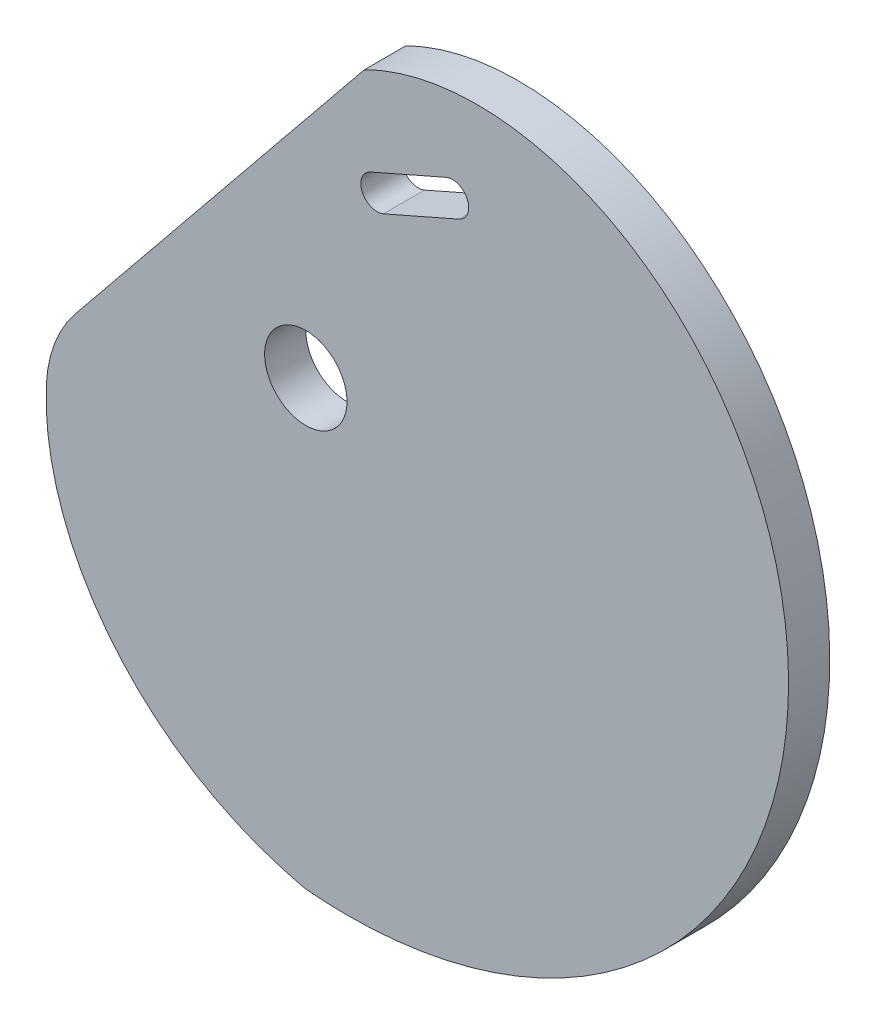
from build123d import *

# Parameters (mm, degrees)
SKETCH1_R               = 6.35
BOSS_EXTRUDE1_DEPTH     = 3.175
CUT_EXTRUDE1_DEPTH      = 102.208623711
CUT_EXTRUDE1_DEPTH_BACK = 102.208623711
FILLET1_R               = 20


with BuildPart() as part:
    # Sketch1 → Boss-Extrude1 (new, symmetric)
    with BuildSketch(Plane.XY):
        with BuildLine():
            add(Edge.make_bspline(
                [(0, -68.230921715), (0.393333706, -68.291733321), (1.194961176, -68.321276753), (2.388868431, -68.414811628), (3.58891617, -68.470136134), (4.791044831, -68.510535556), (5.995946289, -68.52954927), (7.203026535, -68.528713614), (8.412027616, -68.507423129), (9.62259203, -68.465654591), (10.83437986, -68.403235569), (12.047037443, -68.320041284), (13.260205927, -68.215942066), (14.473519127, -68.090817818), (15.686604264, -67.944554476), (16.899081946, -67.777045295), (18.110566359, -67.588190842), (19.320665416, -67.377899329), (20.528980925, -67.146086849), (21.73510877, -66.892677633), (22.938639087, -66.6176043), (24.139156466, -66.320808097), (25.336240146, -66.002239142), (26.529464226, -65.661856654), (27.718397887, -65.299629187), (28.90260561, -64.915534847), (30.081647414, -64.509561514), (31.255079097, -64.081707052), (32.42245248, -63.631979515), (33.58331567, -63.160397343), (34.737213315, -62.666989561), (35.883686879, -62.151795956), (37.022274916, -61.614867262), (38.152513354, -61.056265327), (39.273935784, -60.476063279), (40.386073758, -59.87434568), (41.488457085, -59.251208675), (42.580614147, -58.606760131), (43.662072205, -57.941119771), (44.732357722, -57.254419292), (45.790996682, -56.546802486), (46.837514925, -55.81842534), (47.871438475, -55.069456136), (48.89229388, -54.300075538), (49.899608554, -53.51047667), (50.892911122, -52.700865183), (51.871731772, -51.87145932), (52.835602603, -51.022489959), (53.784057989, -50.154200657), (54.71663493, -49.26684768), (55.632873421, -48.360700021), (56.532316811, -47.436039411), (57.414512174, -46.493160317), (58.279010671, -45.532369935), (59.125367928, -44.553988165), (59.953144401, -43.558347582), (60.761905749, -42.545793391), (61.55122321, -41.516683378), (62.320673971, -40.471387842), (63.069841543, -39.410289525), (63.798316132, -38.333783527), (64.505695017, -37.242277204), (65.191582915, -36.13619007), (65.85559236, -35.015953676), (66.497344063, -33.882011479), (67.11646729, -32.734818707), (67.71260022, -31.574842209), (68.285390316, -30.402560293), (68.834494677, -29.218462553), (69.359580408, -28.023049692), (69.860324965, -26.816833323), (70.336416512, -25.60033577), (70.787554269, -24.374089852), (71.213448854, -23.13863866), (71.613822626, -21.894535318), (71.988410015, -20.642342743), (72.336957858, -19.382633384), (72.659225719, -18.115988959), (72.954986211, -16.843000179), (73.224025309, -15.564266461), (73.466142659, -14.28039563), (73.681151874, -12.992003617), (73.868880836, -11.699714142), (74.029171977, -10.404158388), (74.161882563, -9.10597467), (74.266884966, -7.805808087), (74.344066927, -6.504310174), (74.393331816, -5.202138538), (74.414598879, -3.89995649), (74.407803478, -2.598432666), (74.372897323, -1.29824064), (74.309848696, -5.853e-05), (74.218642658, 1.295431404), (74.099281259, 2.587543173), (73.95178373, 3.875587471), (73.776186663, 5.158872107), (73.572544188, 6.43670243), (73.340928136, 7.708381771), (73.081428188, 8.973211889), (72.794152019, 10.230493418), (72.47922543, 11.479526328), (72.13679246, 12.719610386), (71.767015501, 13.950045625), (71.37007539, 15.170132817), (70.946171493, 16.379173951), (70.495521777, 17.576472716), (70.018362872, 18.761334989), (69.514950114, 19.933069325), (68.985557583, 21.090987453), (68.430478125, 22.234404772), (67.850023359, 23.362640855), (67.244523678, 24.47501995), (66.614328227, 25.570871489), (65.959804877, 26.649530597), (65.281340181, 27.710338599), (64.579339317, 28.752643533), (63.85422602, 29.775800665), (63.106442497, 30.779173), (62.33644933, 31.762131799), (61.544725366, 32.724057086), (60.731767601, 33.66433818), (59.898090995, 34.582374149), (59.044228508, 35.477574541), (58.170730235, 36.349359075), (57.278166357, 37.197160694), (56.367121668, 38.020410915), (55.438270074, 38.818621759), (54.492318121, 39.591335254), (53.529982536, 40.3381068), (52.551992493, 41.058512637), (51.559087829, 41.752148676), (50.552018856, 42.418631155), (49.531545735, 43.057596786), (48.498437965, 43.668703015), (47.453473832, 44.251628246), (46.397439863, 44.806072049), (45.331130274, 45.331755356), (44.255346411, 45.828420647), (43.17089619, 46.295832116), (42.078593533, 46.733775825), (40.979257798, 47.142059848), (39.873713209, 47.520514394), (38.762788284, 47.868991924), (37.647315256, 48.187367242), (36.528129497, 48.475537585), (35.406068937, 48.733422689), (34.281973488, 48.960964845), (33.156684455, 49.158128938), (32.031043959, 49.324902476), (30.905894352, 49.461295599), (29.78207764, 49.567341079), (28.66043489, 49.643094299), (27.541805663, 49.688633226), (26.427027423, 49.704058363), (25.316934962, 49.689492689), (24.212359828, 49.645081585), (23.114129743, 49.570992746), (22.023068037, 49.46741608), (20.939993076, 49.334563587), (19.865717696, 49.172669234), (18.801048645, 48.981988806), (17.746786017, 48.762799751), (16.703722704, 48.515401007), (15.672643843, 48.240112817), (14.654326272, 47.93727653), (13.64953799, 47.607254389), (12.659037622, 47.250429307), (11.683573889, 46.867204624), (10.723885088, 46.458003864), (9.780698574, 46.023270462), (8.85473025, 45.563467495), (7.946684063, 45.079077388), (7.057251515, 44.570601617), (6.187111156, 44.038560382), (5.336928158, 43.48349234), (4.507353656, 42.905954051), (3.699024971, 42.306520427), (2.912619563, 41.685826384), (2.149082762, 41.044776761), (1.408732666, 40.385653153), (0.69201842, 39.710962437), (-0.000702823, 39.023274092), (-0.669224606, 38.325164066), (-1.313490613, 37.619209289), (-1.933594741, 36.907981167), (-2.529780734, 36.194039342), (-3.102441662, 35.479925366), (-3.652119172, 34.768156406), (-4.179502537, 34.061218936), (-4.68542751, 33.361562432), (-5.170874981, 32.671593072), (-5.636969475, 31.993667421), (-6.084977486, 31.330086125), (-6.5163057, 30.68308757), (-6.932499191, 30.054841594), (-7.335239472, 29.447442991), (-7.726343211, 28.862905788), (-8.107759261, 28.30315506), (-8.481572996, 27.770028153), (-8.850055929, 27.265150233), (-9.21599154, 26.789707359), (-9.58007402, 26.342396401), (-9.943199031, 25.921274986), (-10.306211946, 25.524302901), (-10.669815304, 25.149428396), (-11.03457423, 24.794597749), (-11.400917427, 24.457759077), (-11.769139802, 24.136868148), (-12.139404915, 23.829894257), (-12.511747444, 23.534826559), (-12.886075425, 23.249680558), (-13.262172288, 22.972504592), (-13.639698706, 22.701386132), (-14.018194373, 22.4344578), (-14.397079826, 22.169903041), (-14.775658393, 21.905961469), (-15.153118349, 21.640933911), (-15.528535328, 21.37318718), (-15.900874865, 21.101158728), (-16.268995598, 20.823360748), (-16.631651048, 20.538385549), (-16.987497448, 20.244905703), (-17.335071725, 19.941700072), (-17.674482118, 19.629485326), (-18.005889299, 19.308945872), (-18.329486913, 18.98074786), (-18.645506177, 18.6455329), (-18.954213469, 18.303917657), (-19.255909475, 17.956492143), (-19.550927855, 17.603818409), (-19.839633983, 17.246429189), (-20.122423608, 16.884826615), (-20.39972148, 16.519480973), (-20.671979932, 16.15082951), (-20.93967742, 15.77927529), (-21.203317027, 15.405186109), (-21.463424922, 15.028893458), (-21.720548787, 14.650691546), (-21.975256201, 14.270836377), (-22.228133, 13.889544888), (-22.479781587, 13.506994147), (-22.730819224, 13.123320602), (-22.981876279, 12.738619403), (-23.233594452, 12.35294377), (-23.486624965, 11.966304432), (-23.741626724, 11.578669117), (-23.999264462, 11.189962103), (-24.260206854, 10.800063825), (-24.52512461, 10.408810538), (-24.794688561, 10.015994037), (-25.069567717, 9.621361426), (-25.350427363, 9.224614974), (-25.637926993, 8.8254119), (-25.932718851, 8.423364715), (-26.235444149, 8.018039723), (-26.546738212, 7.608962846), (-26.867193334, 7.195608336), (-27.197393741, 6.777566684), (-27.537037782, 6.353934602), (-27.885559202, 5.923803469), (-28.242374703, 5.486366009), (-28.606855737, 5.040842301), (-28.978345064, 4.586492757), (-29.356154138, 4.122615768), (-29.739565815, 3.648549546), (-30.127835637, 3.163672741), (-30.520193566, 2.667405334), (-30.915845631, 2.159209384), (-31.313975642, 1.638589743), (-31.713746908, 1.10509472), (-32.114303997, 0.558316687), (-32.514774496, -0.002107372), (-32.914270801, -0.576495363), (-33.311891916, -1.165119646), (-33.70672526, -1.768206653), (-34.097848491, -2.385936568), (-34.484331334, -3.01844306), (-34.865237414, -3.665813085), (-35.239626095, -4.328086735), (-35.606554319, -5.00525716), (-35.965078448, -5.697270543), (-36.314256102, -6.404026134), (-36.653147994, -7.125376348), (-36.98081976, -7.861126926), (-37.296343783, -8.611037148), (-37.598801011, -9.374820113), (-37.887282738, -10.15214308), (-38.160892488, -10.942627847), (-38.418747446, -11.745851279), (-38.659981522, -12.561345551), (-38.883742182, -13.388599746), (-39.089211497, -14.227059816), (-39.27554787, -15.076191303), (-39.442240692, -15.935443066), (-39.58900499, -16.804297383), (-39.715531283, -17.682274795), (-39.821534024, -18.56888584), (-39.906736403, -19.463633732), (-39.970874682, -20.366013757), (-40.01369729, -21.27551381), (-40.034965324, -22.191614638), (-40.034452659, -23.113790166), (-40.011946156, -24.041507803), (-39.967245835, -24.974228766), (-39.900165044, -25.911408403), (-39.810530622, -26.852496518), (-39.698183052, -27.796937709), (-39.56297661, -28.744171699), (-39.4047795, -29.693633681), (-39.223473982, -30.64475466), (-39.018956498, -31.596961802), (-38.791137779, -32.549678783), (-38.539942955, -33.502326148), (-38.265311644, -34.454321664), (-37.967198044, -35.405080681), (-37.645571006, -36.354016496), (-37.300414107, -37.300540716), (-36.931725709, -38.244063627), (-36.539519007, -39.18399456), (-36.123822074, -40.119742265), (-35.684677893, -41.050715279), (-35.222144381, -41.976322302), (-34.736294403, -42.89597257), (-34.227215775, -43.809076229), (-33.695011264, -44.715044715), (-33.139798572, -45.613291121), (-32.561710315, -46.503230581), (-31.960893988, -47.384280643), (-31.337511928, -48.255861642), (-30.69174126, -49.117397078), (-30.023773839, -49.96831399), (-29.333816181, -50.808043326), (-28.622089382, -51.636020317), (-27.888829033, -52.451684847), (-27.134285123, -53.25448182), (-26.358721931, -54.04386153), (-25.562417912, -54.819280022), (-24.745665571, -55.580199454), (-23.908771332, -56.326088459), (-23.052055394, -57.0564225), (-22.175851579, -57.770684224), (-21.280507172, -58.468363812), (-20.366382752, -59.148959324), (-19.433852012, -59.811977048), (-18.483301577, -60.456931829), (-17.515130802, -61.083347415), (-16.529751575, -61.690756781), (-15.527588097, -62.278702456), (-14.50907667, -62.846736843), (-13.474665463, -63.39442255), (-12.424814268, -63.921332635), (-11.359994294, -64.427051169), (-10.280687768, -64.911172569), (-9.187388219, -65.373305515), (-8.080598179, -65.813059652), (-6.960836498, -66.230096831), (-5.828609627, -66.623940268), (-4.684517934, -66.994691537), (-3.528855652, -67.340343195), (-2.3631095, -67.666856553), (-1.184338477, -67.950378607), (-0.400093515, -68.169065005), (0, -68.230921715)],
                knots=[0, 0, 0, 0, 0.003319606, 0.00664483, 0.00997572, 0.013312315, 0.016654652, 0.020002764, 0.023356679, 0.026716422, 0.030082012, 0.033453467, 0.036830797, 0.040214011, 0.043603114, 0.046998106, 0.050398984, 0.05380574, 0.057218364, 0.060636841, 0.064061153, 0.067491279, 0.070927192, 0.074368865, 0.077816264, 0.081269354, 0.084728096, 0.088192446, 0.09166236, 0.095137787, 0.098618675, 0.102104968, 0.105596607, 0.10909353, 0.112595671, 0.116102963, 0.119615332, 0.123132706, 0.126655005, 0.130182149, 0.133714056, 0.137250637, 0.140791804, 0.144337465, 0.147887524, 0.151441884, 0.155000443, 0.158563099, 0.162129745, 0.165700272, 0.169274569, 0.172852522, 0.176434014, 0.180018926, 0.183607137, 0.187198521, 0.190792953, 0.194390304, 0.197990441, 0.201593231, 0.205198539, 0.208806224, 0.212416148, 0.216028167, 0.219642135, 0.223257906, 0.226875331, 0.230494258, 0.234114533, 0.237736001, 0.241358506, 0.244981886, 0.248605983, 0.252230632, 0.255855669, 0.259480928, 0.263106241, 0.266731437, 0.270356345, 0.273980794, 0.277604607, 0.281227611, 0.284849627, 0.288470478, 0.292089983, 0.295707963, 0.299324234, 0.302938615, 0.306550921, 0.310160967, 0.313768569, 0.317373538, 0.320975689, 0.324574833, 0.328170782, 0.331763348, 0.335352341, 0.338937573, 0.342518853, 0.346095993, 0.349668803, 0.353237093, 0.356800674, 0.360359359, 0.363912958, 0.367461284, 0.37100415, 0.37454137, 0.37807276, 0.381598135, 0.385117313, 0.388630113, 0.392136355, 0.395635862, 0.399128458, 0.402613969, 0.406092224, 0.409563054, 0.413026294, 0.416481778, 0.419929348, 0.423368847, 0.426800121, 0.43022302, 0.4336374, 0.437043112, 0.440439966, 0.443827754, 0.447206268, 0.450575308, 0.453934675, 0.457284173, 0.460623612, 0.463952804, 0.467271567, 0.470579721, 0.473877092, 0.477163509, 0.480438807, 0.483702825, 0.486955407, 0.490196401, 0.493425661, 0.496643048, 0.499848424, 0.50304166, 0.506222633, 0.509391223, 0.512547319, 0.515690814, 0.518821608, 0.521939609, 0.52504473, 0.528136891, 0.531216019, 0.53428205, 0.537334925, 0.540374595, 0.543401017, 0.546414157, 0.549413988, 0.552400493, 0.555373664, 0.5583335, 0.56128001, 0.564213213, 0.567133138, 0.570039821, 0.572933311, 0.575813665, 0.578680954, 0.581535256, 0.58437666, 0.58720527, 0.590021199, 0.59282457, 0.59561552, 0.598394199, 0.601160164, 0.603910525, 0.606641733, 0.609350191, 0.612032273, 0.614684334, 0.617302722, 0.619883791, 0.622423916, 0.624919509, 0.627367038, 0.629763043, 0.632104166, 0.634387177, 0.636609005, 0.638766786, 0.640857908, 0.642880081, 0.644831406, 0.646710483, 0.648516525, 0.650249514, 0.65191136, 0.653508519, 0.655048349, 0.65653798, 0.657984241, 0.659393583, 0.66077201, 0.662125022, 0.663457568, 0.664774018, 0.666078151, 0.667373165, 0.668661696, 0.669945853, 0.671227263, 0.672507127, 0.673786273, 0.67506522, 0.676344239, 0.677623416, 0.678902717, 0.68018205, 0.681461324, 0.682740438, 0.684019262, 0.685297659, 0.686575488, 0.687852615, 0.689128915, 0.690404281, 0.691678632, 0.692951916, 0.694224122, 0.695495279, 0.696765474, 0.698034846, 0.699303605, 0.70057203, 0.70184048, 0.703109399, 0.704379325, 0.705650892, 0.706924838, 0.708202013, 0.709483377, 0.710770009, 0.712063109, 0.713363997, 0.714674119, 0.715995039, 0.717328447, 0.718676146, 0.720040056, 0.721422204, 0.722824718, 0.724249822, 0.725699824, 0.727177002, 0.72868281, 0.730218172, 0.731783831, 0.733380363, 0.735008197, 0.736667628, 0.738358831, 0.740081872, 0.741836722, 0.743623264, 0.745441305, 0.747290584, 0.749170776, 0.751081502, 0.753022336, 0.754992805, 0.756992401, 0.759020578, 0.761076761, 0.763160347, 0.76527071, 0.767407202, 0.769569155, 0.771755887, 0.7739667, 0.776200882, 0.778457713, 0.780736462, 0.783036392, 0.785356757, 0.787696808, 0.790055792, 0.792432952, 0.794827532, 0.797238799, 0.799666426, 0.802110394, 0.804570687, 0.807047284, 0.809540165, 0.812049305, 0.814574675, 0.817116246, 0.819673984, 0.822247852, 0.824837811, 0.82744382, 0.830065834, 0.832703806, 0.835357687, 0.838027424, 0.840712962, 0.843414244, 0.84613121, 0.848863798, 0.851611942, 0.854375576, 0.857154631, 0.859949033, 0.862758708, 0.865583582, 0.868423573, 0.871278601, 0.874148584, 0.877033434, 0.879933066, 0.882847387, 0.885776307, 0.888719732, 0.891677564, 0.894649707, 0.897636058, 0.900636516, 0.903650977, 0.906679333, 0.909721476, 0.912777297, 0.915846682, 0.918929518, 0.922025687, 0.925135072, 0.928257554, 0.931393009, 0.934541315, 0.937702347, 0.940875975, 0.944062073, 0.947260508, 0.950471149, 0.95369386, 0.956928506, 0.960174949, 0.96343305, 0.966702667, 0.969983657, 0.973275876, 0.976579178, 0.979893415, 0.983218438, 0.986554095, 0.989900235, 0.993256703, 0.996623344, 1, 1, 1, 1], degree=3))
        make_face()
        Circle(SKETCH1_R, mode=Mode.SUBTRACT)
        with BuildLine():
            ThreePointArc((11.984914181, 27.895733584), (8.691133377, 29.180649151), (9.976048944, 32.474429955))
            Line((9.976048944, 32.474429955), (21.605937727, 37.576947657))
            ThreePointArc((21.605937727, 37.576947657), (24.899718531, 36.29203209), (23.614802964, 32.998251286))
            Line((23.614802964, 32.998251286), (11.984914181, 27.895733584))
        make_face(mode=Mode.SUBTRACT)
    extrude(amount=BOSS_EXTRUDE1_DEPTH, both=True)

    # Sketch2 → Cut-Extrude1 (cut, two sides: drawn at the far end of the back side and taken through both)
    with BuildSketch(Plane.XY.offset(-CUT_EXTRUDE1_DEPTH_BACK)):
        Polygon((-35.700141367, -3.650772794), (-5.287048439, 46.63912797), (7.47895927, 46.63912797), (9.017790377, 45.641265466), (-41.200196706, -16.19692185), align=None)
    extrude(amount=CUT_EXTRUDE1_DEPTH + CUT_EXTRUDE1_DEPTH_BACK, mode=Mode.SUBTRACT)

    # Fillet1
    fillet1_edges = [part.edges().sort_by_distance(p)[0] for p in [
        (-38.861787447, -13.317415956, -1.5875),
    ]]
    fillet(fillet1_edges, radius=FILLET1_R)


solid = part.part
